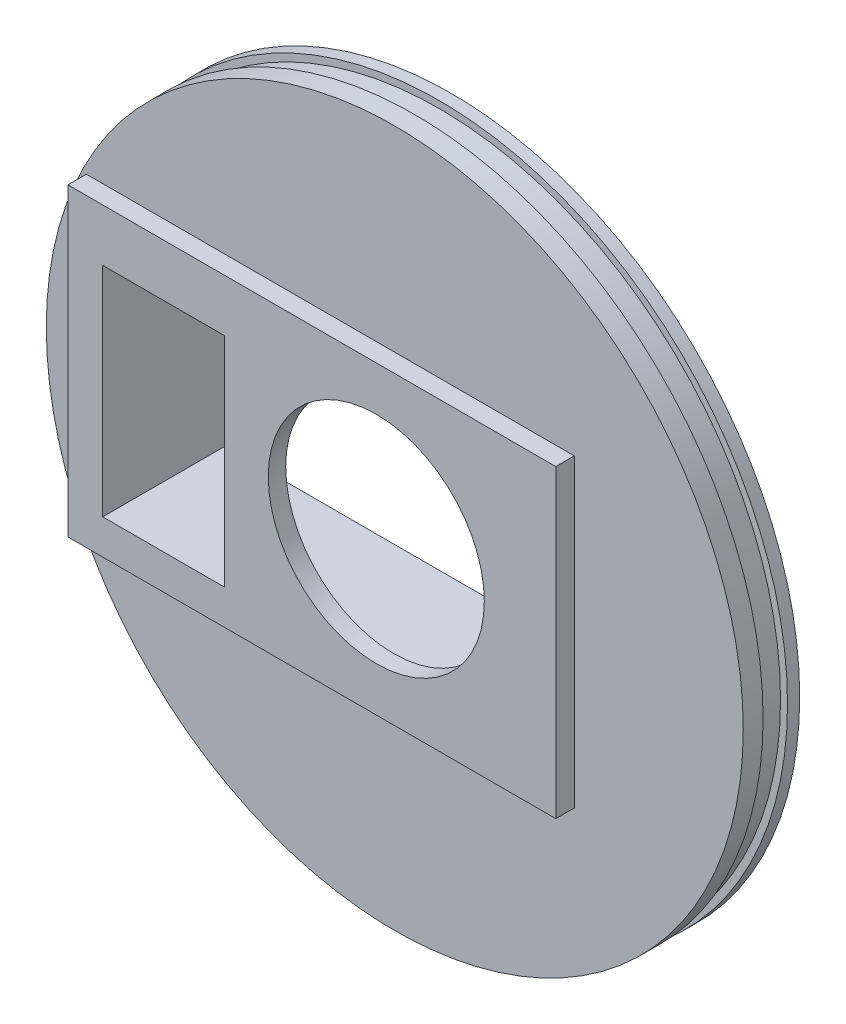
from build123d import *

# Parameters (mm, degrees)
SKETCH1_R                = 31
BOSS_EXTRUDE1_DEPTH      = 5
BOSS_EXTRUDE2_DEPTH      = 30
BOSS_EXTRUDE2_DEPTH_BACK = 5
SKETCH2_W                = 140
SKETCH2_H                = 87.5
SKETCH2_W_2              = 120
SKETCH2_H_2              = 67.5
BOSS_EXTRUDE3_START      = -6.5
BOSS_EXTRUDE3_OUTLINE_R  = 100
BOSS_EXTRUDE3_OUTLINE_W  = 140
BOSS_EXTRUDE3_OUTLINE_H  = 87.5
BOSS_EXTRUDE3_DEPTH      = 16.196699026
SKETCH4_W                = 7
SKETCH4_H                = 2
FILLET1_R                = 5
SKETCH5_R                = 1.5
CUT_EXTRUDE1_DEPTH       = 10


# Read off the part's stored shape, not the designer's step: Boss-Extrude3
with BuildPart() as part:
    # Sketch1 → Boss-Extrude1 (new body)
    with BuildSketch(Plane.XY):
        Polygon((41.5, 33.75), (-78.5, 33.75), (-78.5, 28.75), (-43.5, 28.75), (-43.5, -33.75), (41.5, -33.75), align=None)
        Circle(SKETCH1_R, mode=Mode.SUBTRACT)
    extrude(amount=-BOSS_EXTRUDE1_DEPTH)

    # Sketch2 → Boss-Extrude2 (add, two sides: drawn at the far end of the back side and taken through both)
    with BuildSketch(Plane(origin=(0, 0, -5), x_dir=(-1, 0, 0), z_dir=(0, 0, -1)).offset(-BOSS_EXTRUDE2_DEPTH_BACK)):
        with Locations((18.5, 0)):
            Rectangle(SKETCH2_W, SKETCH2_H)
        with Locations((18.5, 0)):
            Rectangle(SKETCH2_W_2, SKETCH2_H_2, mode=Mode.SUBTRACT)
    extrude(amount=BOSS_EXTRUDE2_DEPTH + BOSS_EXTRUDE2_DEPTH_BACK)

    # Boss-Extrude3 outline → Boss-Extrude3 (add)
    with BuildSketch(Plane.XY.offset(-15).offset(BOSS_EXTRUDE3_START)):
        Circle(BOSS_EXTRUDE3_OUTLINE_R)
        with Locations((-18.5, 0)):
            Rectangle(BOSS_EXTRUDE3_OUTLINE_W, BOSS_EXTRUDE3_OUTLINE_H, mode=Mode.SUBTRACT)
    extrude(amount=BOSS_EXTRUDE3_DEPTH)

    # Sketch4 → Cut-Revolve1 (revolve, cut)
    with BuildSketch(Plane(origin=(0, 0, 0), x_dir=(0, 0, -1), z_dir=(1, 0, 0)), mode=Mode.PRIVATE) as cut_revolve1_sk:
        with Locations((14.5, 99)):
            Rectangle(SKETCH4_W, SKETCH4_H)
    revolve(cut_revolve1_sk.sketch.rotate(Axis((0, 0, 0), (0, 0, -1)), 90), axis=Axis((0, 0, 0), (0, 0, -1)), mode=Mode.SUBTRACT)

    # Fillet1
    fillet1_edges = [part.edges().sort_by_distance(p)[0] for p in [
        (-88.5, -43.75, -28.25),
        (51.5, -43.75, -28.25),
        (-88.5, 43.75, -28.25),
        (51.5, 43.75, -28.25),
    ]]
    fillet(fillet1_edges, radius=FILLET1_R)

    # Sketch5 → Cut-Extrude1 (cut)
    with BuildSketch(Plane(origin=(0, 0, -35), x_dir=(-1, 0, 0), z_dir=(0, 0, -1))):
        with Locations((-46.5, 38.75)):
            Circle(SKETCH5_R)
        with Locations((-46.5, -38.75)):
            Circle(SKETCH5_R)
        with Locations((83.5, -38.75)):
            Circle(SKETCH5_R)
        with Locations((83.5, 38.75)):
            Circle(SKETCH5_R)
    extrude(amount=-CUT_EXTRUDE1_DEPTH, mode=Mode.SUBTRACT)


solid = part.part
